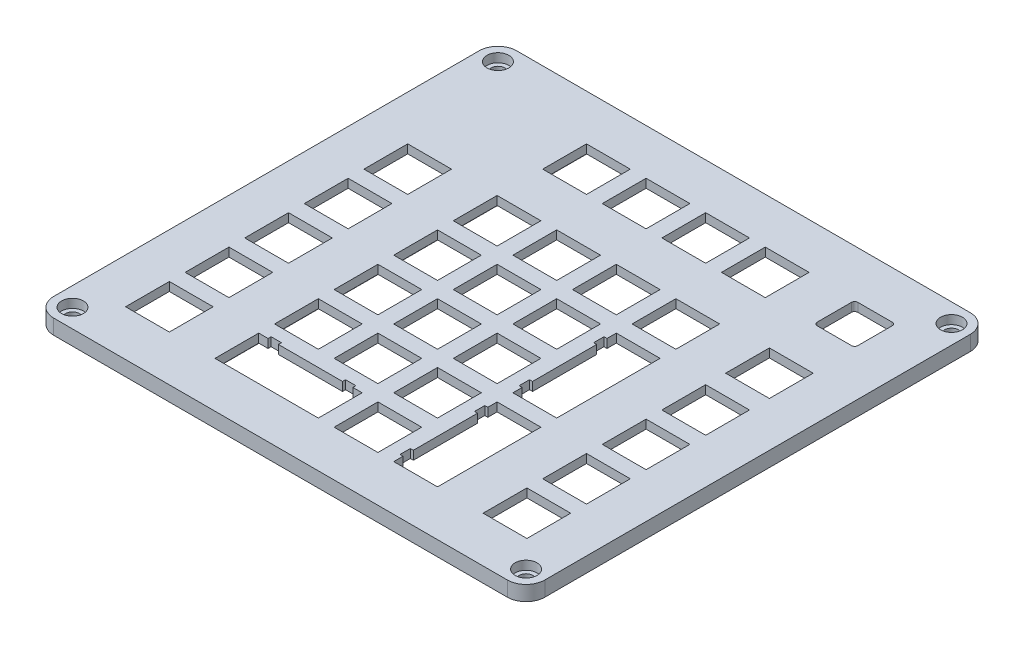
from build123d import *

# Parameters (mm, degrees)
SKETCH1_R           = 2.15
SKETCH1_W           = 13
SKETCH1_H           = 13
SKETCH1_W_2         = 14.000007544
SKETCH1_H_2         = 13.999507543
SKETCH1_W_3         = 13.999607544
SKETCH1_W_4         = 14.000907544
SKETCH1_H_3         = 13.999707543
SKETCH1_H_4         = 13.999607544
SKETCH1_H_5         = 13.999407544
SKETCH1_H_6         = 13.999007544
BOSS_EXTRUDE1_DEPTH = 4.78
SKETCH2_W           = 137
SKETCH2_H           = 128
CUT_EXTRUDE1_DEPTH  = 2
SKETCH4_W           = 15
SKETCH4_H           = 7
CUT_EXTRUDE2_DEPTH  = 2
SKETCH5_W           = 20
SKETCH5_H           = 7.5
CUT_EXTRUDE3_DEPTH  = 2
SKETCH6_R           = 3.5
CUT_EXTRUDE4_DEPTH  = 2.8
FILLET1_R           = 1
SKETCH7_W           = 6
SKETCH7_H           = 128
BOSS_EXTRUDE2_DEPTH = 2
SKETCH8_W           = 75
SKETCH8_H           = 7
BOSS_EXTRUDE3_DEPTH = 2
SKETCH9_W           = 6
SKETCH9_H           = 95
BOSS_EXTRUDE4_DEPTH = 2
SKETCH10_W          = 15
SKETCH10_H          = 7
BOSS_EXTRUDE5_DEPTH = 2
FILLET2_R           = 2.5


with BuildPart() as part:
    # Sketch1 → Boss-Extrude1 (new body)
    with BuildSketch(Plane(origin=(0, 0, 0), x_dir=(1, 0, 0), z_dir=(0, 1, 0))):
        with BuildLine():
            Line((157.095084651, 142.42407674), (157.095084651, 6.42408329))
            ThreePointArc((157.095084651, 6.42408329), (155.337724391, 2.181440316), (151.095081418, 0.424080056))
            Line((151.095081418, 0.424080056), (6.095053284, 0.424080056))
            ThreePointArc((6.095053284, 0.424080056), (1.852434777, 2.181430182), (0.095084651, 6.424048689))
            Line((0.095084651, 6.424048689), (0.095084651, 142.425076746))
            ThreePointArc((0.095084651, 142.425076746), (1.85215204, 146.667012667), (6.094087961, 148.424080056))
            Line((6.094087961, 148.424080056), (151.095081335, 148.424080056))
            ThreePointArc((151.095081335, 148.424080056), (155.337724367, 146.666719772), (157.095084651, 142.42407674))
        make_face()
        with Locations(Location((6.095084651, 142.424080056, 0), (0, 0, 270))):
            Circle(SKETCH1_R, mode=Mode.SUBTRACT)
        with Locations(Location((151.094123781, 142.424552972, 0), (0, 0, 90))):
            Circle(SKETCH1_R, mode=Mode.SUBTRACT)
        with Locations(Location((151.093705641, 6.423643959, 0), (0, 0, 270))):
            Circle(SKETCH1_R, mode=Mode.SUBTRACT)
        with Locations(Location((6.094666516, 6.425008486, 0), (0, 0, 90))):
            Circle(SKETCH1_R, mode=Mode.SUBTRACT)
        with Locations((135.744073146, 126.813568334)):
            Rectangle(SKETCH1_W, SKETCH1_H, mode=Mode.SUBTRACT)
        Polygon((76.06914099, 15.038508104), (76.06914099, 29.038015647), (73.093839387, 29.038015647), (73.093839387, 30.00811617), (69.795037609, 30.00811617), (69.795037609, 29.038015647), (49.293626562, 29.038015647), (49.293626562, 30.00811617), (45.994824784, 30.00811617), (45.994824784, 29.038015647), (43.019523181, 29.038015647), (43.019523181, 15.038508104), align=None, mode=Mode.SUBTRACT)
        with Locations((135.744073146, 22.038261876)):
            Rectangle(SKETCH1_W_2, SKETCH1_H_2, mode=Mode.SUBTRACT)
        Polygon((100.169053976, 48.088225912), (100.169053976, 45.112924309), (99.199453454, 45.112924309), (99.199453454, 41.812322531), (100.169053976, 41.812322531), (100.169053976, 21.312811484), (99.199453454, 21.312811484), (99.199453454, 18.012309706), (100.169053976, 18.012309706), (100.169053976, 15.038508104), (114.16906152, 15.038508104), (114.16906152, 48.088225912), align=None, mode=Mode.SUBTRACT)
        with Locations((88.119347483, 22.038261876)):
            Rectangle(SKETCH1_W_3, SKETCH1_H_2, mode=Mode.SUBTRACT)
        with Locations((21.443661555, 22.038261876)):
            Rectangle(SKETCH1_W_4, SKETCH1_H_2, mode=Mode.SUBTRACT)
        with Locations((135.744073146, 41.08837214)):
            Rectangle(SKETCH1_W_2, SKETCH1_H_3, mode=Mode.SUBTRACT)
        with Locations((88.119347483, 41.08837214)):
            Rectangle(SKETCH1_W_3, SKETCH1_H_3, mode=Mode.SUBTRACT)
        with Locations((69.069337218, 41.08837214)):
            Rectangle(SKETCH1_W_3, SKETCH1_H_3, mode=Mode.SUBTRACT)
        with Locations((50.019326953, 41.08837214)):
            Rectangle(SKETCH1_W_3, SKETCH1_H_3, mode=Mode.SUBTRACT)
        with Locations((21.443661555, 41.08837214)):
            Rectangle(SKETCH1_W_4, SKETCH1_H_3, mode=Mode.SUBTRACT)
        with Locations((135.744073146, 60.138432406)):
            Rectangle(SKETCH1_W_2, SKETCH1_H_4, mode=Mode.SUBTRACT)
        Polygon((100.169053976, 86.188246443), (100.169053976, 83.21294484), (99.199453454, 83.21294484), (99.199453454, 79.912343061), (100.169053976, 79.912343061), (100.169053976, 59.412732015), (99.199453454, 59.412732015), (99.199453454, 56.112530236), (100.169053976, 56.112530236), (100.169053976, 53.138628634), (114.16906152, 53.138628634), (114.16906152, 86.188246443), align=None, mode=Mode.SUBTRACT)
        with Locations((88.119347483, 60.138432406)):
            Rectangle(SKETCH1_W_3, SKETCH1_H_4, mode=Mode.SUBTRACT)
        with Locations((69.069337218, 60.138432406)):
            Rectangle(SKETCH1_W_3, SKETCH1_H_4, mode=Mode.SUBTRACT)
        with Locations((50.019326953, 60.138432406)):
            Rectangle(SKETCH1_W_3, SKETCH1_H_4, mode=Mode.SUBTRACT)
        with Locations((21.443661555, 60.138432406)):
            Rectangle(SKETCH1_W_4, SKETCH1_H_4, mode=Mode.SUBTRACT)
        with Locations((135.744073146, 79.188442671)):
            Rectangle(SKETCH1_W_2, SKETCH1_H_4, mode=Mode.SUBTRACT)
        with Locations((88.119347483, 79.188442671)):
            Rectangle(SKETCH1_W_3, SKETCH1_H_4, mode=Mode.SUBTRACT)
        with Locations((69.069337218, 79.188442671)):
            Rectangle(SKETCH1_W_3, SKETCH1_H_4, mode=Mode.SUBTRACT)
        with Locations((50.019326953, 79.188442671)):
            Rectangle(SKETCH1_W_3, SKETCH1_H_4, mode=Mode.SUBTRACT)
        with Locations((21.443661555, 79.188442671)):
            Rectangle(SKETCH1_W_4, SKETCH1_H_4, mode=Mode.SUBTRACT)
        with Locations((135.744073146, 99.555083908)):
            Rectangle(SKETCH1_W_2, SKETCH1_H_5, mode=Mode.SUBTRACT)
        with Locations((107.169057748, 98.238352936)):
            Rectangle(SKETCH1_W_2, SKETCH1_H_5, mode=Mode.SUBTRACT)
        with Locations((88.119347483, 98.238352936)):
            Rectangle(SKETCH1_W_3, SKETCH1_H_5, mode=Mode.SUBTRACT)
        with Locations((69.069337218, 98.238352936)):
            Rectangle(SKETCH1_W_3, SKETCH1_H_5, mode=Mode.SUBTRACT)
        with Locations((50.019326953, 98.238352936)):
            Rectangle(SKETCH1_W_3, SKETCH1_H_5, mode=Mode.SUBTRACT)
        with Locations((21.443661555, 98.238352936)):
            Rectangle(SKETCH1_W_4, SKETCH1_H_5, mode=Mode.SUBTRACT)
        with Locations((107.169057748, 126.813568334)):
            Rectangle(SKETCH1_W_2, SKETCH1_H_6, mode=Mode.SUBTRACT)
        with Locations((88.119347483, 126.813568334)):
            Rectangle(SKETCH1_W_3, SKETCH1_H_6, mode=Mode.SUBTRACT)
        with Locations((69.069337218, 126.813568334)):
            Rectangle(SKETCH1_W_3, SKETCH1_H_6, mode=Mode.SUBTRACT)
        with Locations((50.019326953, 126.813568334)):
            Rectangle(SKETCH1_W_3, SKETCH1_H_6, mode=Mode.SUBTRACT)
    extrude(amount=BOSS_EXTRUDE1_DEPTH)

    # Sketch2 → Cut-Extrude1 (cut)
    with BuildSketch(Plane.XZ):
        with Locations((78.595084651, -74.424080056)):
            Rectangle(SKETCH2_W, SKETCH2_H)
    extrude(amount=-CUT_EXTRUDE1_DEPTH, mode=Mode.SUBTRACT)

    # Sketch4 → Cut-Extrude2 (cut)
    with BuildSketch(Plane.XZ):
        with Locations((124.595084651, -141.924080056)):
            Rectangle(SKETCH4_W, SKETCH4_H)
    extrude(amount=-CUT_EXTRUDE2_DEPTH, mode=Mode.SUBTRACT)

    # Sketch5 → Cut-Extrude3 (cut)
    with BuildSketch(Plane.XZ):
        with Locations((25.095084651, -142.174080056)):
            Rectangle(SKETCH5_W, SKETCH5_H)
    extrude(amount=-CUT_EXTRUDE3_DEPTH, mode=Mode.SUBTRACT)

    # Sketch6 → Cut-Extrude4 (cut)
    with BuildSketch(Plane(origin=(0, 4.78, 0), x_dir=(1, 0, 0), z_dir=(0, 1, 0))):
        with Locations(Location((6.095084651, 142.424080056, 0), (0, 0, 270))):
            Circle(SKETCH6_R)
        with Locations(Location((151.094123781, 142.424552972, 0), (0, 0, 270))):
            Circle(SKETCH6_R)
        with Locations(Location((151.093705641, 6.423643959, 0), (0, 0, 270))):
            Circle(SKETCH6_R)
        with Locations(Location((6.094666516, 6.425008486, 0), (0, 0, 270))):
            Circle(SKETCH6_R)
    extrude(amount=-CUT_EXTRUDE4_DEPTH, mode=Mode.SUBTRACT)

    # Fillet1
    fillet1_edges = [part.edges().sort_by_distance(p)[0] for p in [
        (142.244073146, 3.39, -120.313568334),
        (142.244073146, 3.39, -133.313568334),
        (129.244073146, 3.39, -133.313568334),
        (129.244073146, 3.39, -120.313568334),
    ]]
    fillet(fillet1_edges, radius=FILLET1_R)

    # Sketch7 → Boss-Extrude2 (add)
    with BuildSketch(Plane.XZ.offset(-2)):
        with Locations((38.095084651, -74.424080056)):
            Rectangle(SKETCH7_W, SKETCH7_H)
    extrude(amount=BOSS_EXTRUDE2_DEPTH)

    # Sketch8 → Boss-Extrude3 (add)
    with BuildSketch(Plane.XZ.offset(-2)):
        with Locations((78.595084651, -112.738056708)):
            Rectangle(SKETCH8_W, SKETCH8_H)
    extrude(amount=BOSS_EXTRUDE3_DEPTH)

    # Sketch9 → Boss-Extrude4 (add)
    with BuildSketch(Plane.XZ.offset(-2)):
        with Locations((123.744069374, -57.924080056)):
            Rectangle(SKETCH9_W, SKETCH9_H)
    extrude(amount=BOSS_EXTRUDE4_DEPTH)

    # Sketch10 → Boss-Extrude5 (add)
    with BuildSketch(Plane.XZ.offset(-2)):
        with Locations((139.595084651, -112.738056708)):
            Rectangle(SKETCH10_W, SKETCH10_H)
    extrude(amount=BOSS_EXTRUDE5_DEPTH)

    # Fillet2
    fillet2_edges = [part.edges().sort_by_distance(p)[0] for p in [
        (147.095084651, 1, -10.424080056),
        (147.095084651, 1, -138.424080056),
        (10.095084651, 1, -138.424080056),
        (10.095084651, 1, -10.424080056),
        (117.095084651, 1, -138.424080056),
        (132.095084651, 1, -138.424080056),
        (132.095084651, 1, -145.424080056),
        (117.095084651, 1, -145.424080056),
        (35.095084651, 1, -145.924080056),
        (15.095084651, 1, -145.924080056),
        (15.095084651, 1, -138.424080056),
        (41.095084651, 1, -138.424080056),
        (41.095084651, 1, -10.424080056),
        (35.095084651, 1, -10.424080056),
        (41.095084651, 1, -109.238056708),
        (41.095084651, 1, -116.238056708),
        (116.095084651, 1, -116.238056708),
        (116.095084651, 1, -109.238056708),
        (126.744069374, 1, -10.424080056),
        (120.744069374, 1, -10.424080056),
        (120.744069374, 1, -105.424080056),
        (126.744069374, 1, -105.424080056),
        (147.095084651, 1, -116.238056708),
        (147.095084651, 1, -109.238056708),
        (132.095084651, 1, -109.238056708),
        (132.095084651, 1, -116.238056708),
    ]]
    fillet(fillet2_edges, radius=FILLET2_R - 0.0001)  # a hair under: the kernel refuses the full size


solid = part.part
